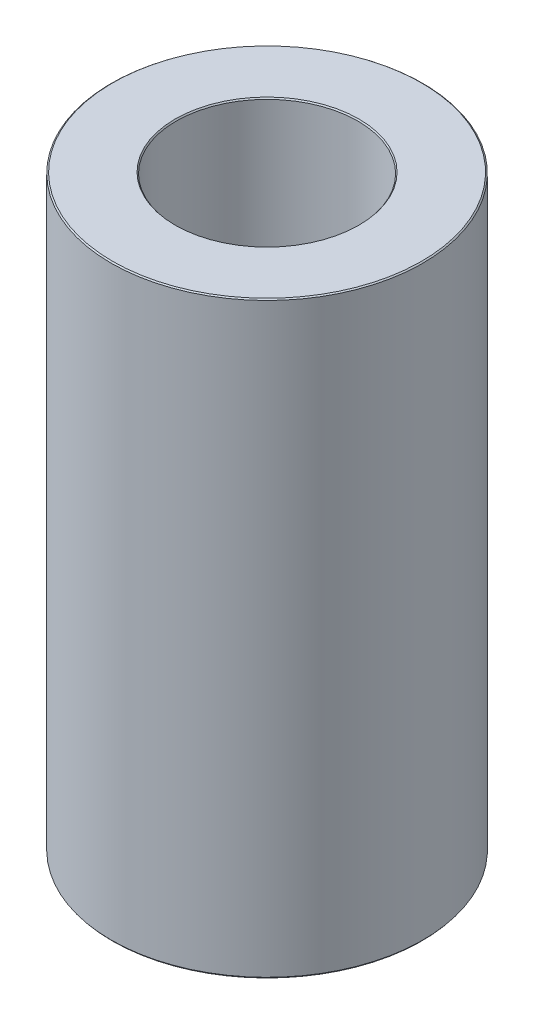
from build123d import *
from OCP.BRepFilletAPI import BRepFilletAPI_MakeChamfer

# Parameters (mm, degrees)
SKETCH1_R           = 50
BOSS_EXTRUDE1_DEPTH = 188.86551107
SKETCH2_R           = 29.176828144
CUT_EXTRUDE1_DEPTH  = 202.668493503
CHAMFER1_SIZE       = 0.328629185
CHAMFER1_SIZE2      = 0.412753053


with BuildPart() as part:
    # Sketch1 → Boss-Extrude1 (new body)
    with BuildSketch(Plane(origin=(0, 0, 0), x_dir=(1, 0, 0), z_dir=(0, 1, 0))):
        Circle(SKETCH1_R)
    extrude(amount=BOSS_EXTRUDE1_DEPTH)

    # Sketch2 → Cut-Extrude1 (cut, through all)
    with BuildSketch(Plane(origin=(0, 0, 0), x_dir=(1, 0, 0), z_dir=(0, 1, 0))):
        Circle(SKETCH2_R)
    extrude(amount=CUT_EXTRUDE1_DEPTH, mode=Mode.SUBTRACT)

    # Chamfer1: one chamfer whose edges measure the first distance from different faces: ONE call of the kernel's chamfer builder (chamfer() names one face for all edges)
    chamfer1_edges_1 = [part.edges().sort_by_distance(p)[0] for p in [
        (-29.176828144, 188.86551107, 0),
    ]]
    chamfer1_side_1 = [part.faces().sort_by_distance(p)[0] for p in [
        (-48.585786438, 188.86551107, 0),
    ]]
    chamfer1_edges_2 = [part.edges().sort_by_distance(p)[0] for p in [
        (-29.176828144, 0, 0),
    ]]
    chamfer1_side_2 = [part.faces().sort_by_distance(p)[0] for p in [
        (-29.176828144, 94.432755535, 0),
    ]]
    chamfer1_edges_3 = [part.edges().sort_by_distance(p)[0] for p in [
        (-50, 0, 0),
    ]]
    chamfer1_side_3 = [part.faces().sort_by_distance(p)[0] for p in [
        (-48.585786438, 0, 0),
    ]]
    chamfer1_edges_4 = [part.edges().sort_by_distance(p)[0] for p in [
        (-50, 188.86551107, 0),
    ]]
    chamfer1_side_4 = [part.faces().sort_by_distance(p)[0] for p in [
        (-50, 94.432755535, 0),
    ]]
    chamfer1 = BRepFilletAPI_MakeChamfer(part.part.solid().wrapped)
    for e in chamfer1_edges_1:
        chamfer1.Add(CHAMFER1_SIZE, CHAMFER1_SIZE2, e.wrapped, chamfer1_side_1[0].wrapped)  # the first distance lies on this face
    for e in chamfer1_edges_2:
        chamfer1.Add(CHAMFER1_SIZE, CHAMFER1_SIZE2, e.wrapped, chamfer1_side_2[0].wrapped)  # the first distance lies on this face
    for e in chamfer1_edges_3:
        chamfer1.Add(CHAMFER1_SIZE, CHAMFER1_SIZE2, e.wrapped, chamfer1_side_3[0].wrapped)  # the first distance lies on this face
    for e in chamfer1_edges_4:
        chamfer1.Add(CHAMFER1_SIZE, CHAMFER1_SIZE2, e.wrapped, chamfer1_side_4[0].wrapped)  # the first distance lies on this face
    add(Compound.cast(chamfer1.Shape()), mode=Mode.REPLACE)


solid = part.part
